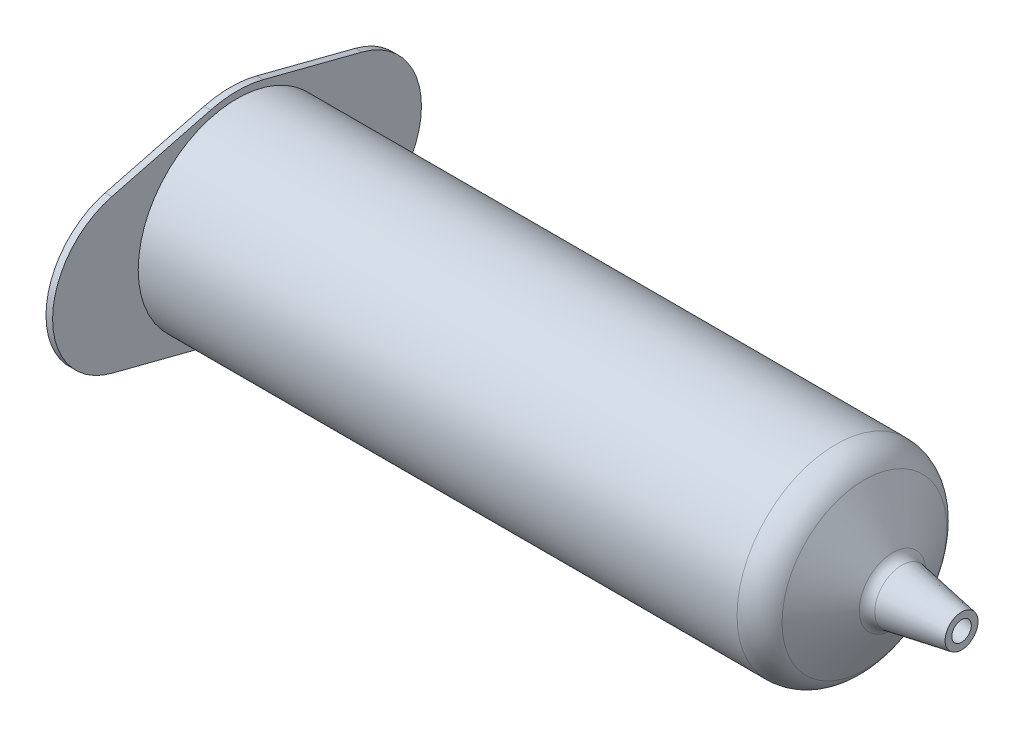
from build123d import *

# Parameters (mm, degrees)
BOSS_EXTRUDE1_DEPTH     = 90
FILLET1_R               = 7.5
FILLET2_R               = 2
SKETCH2_W               = 20
SKETCH2_H               = 80
SKETCH2_W_2             = 32
BOSS_EXTRUDE2_DEPTH     = 20
SKETCH3_R               = 2.5
BOSS_EXTRUDE3_DEPTH     = 111
BOSS_EXTRUDE4_START     = 7.5
SKETCH4_W               = 80
SKETCH4_H               = 20
SKETCH4_R               = 3.25
BOSS_EXTRUDE4_DEPTH     = 20
MOVE_FACE1_BY           = 1.5
MOVE_FACE2_BY           = 1.5
FILLET3_R               = 4
FILLET4_R               = 4
CUT_EXTRUDE1_DEPTH      = 2
BOSS_EXTRUDE5_DEPTH     = 2
SKETCH7_W               = 58
SKETCH7_H               = 15
CUT_EXTRUDE2_DEPTH      = 0.5
SKETCH8_R               = 10
BOSS_EXTRUDE6_DEPTH     = 1.5
SKETCH10_R              = 4.25
SKETCH10_R_2            = 2.75
CUT_EXTRUDE_THIN1_DEPTH = 1.5
SKETCH11_RX             = 5
SKETCH11_RY             = 2.5
BOSS_EXTRUDE7_DEPTH     = 1.5
LPATTERN1_COUNT         = 3
LPATTERN1_PITCH         = 24
SKETCH12_RX             = 5
SKETCH12_RY             = 2.5
BOSS_EXTRUDE8_DEPTH     = 1.5
LPATTERN2_START         = 113.13708499
LPATTERN2_DEPTH         = 1.5
FILLET7_R               = 7.5
FILLET5_R               = 5
FILLET6_R               = 2
SHELL1_T                = -1
SKETCH14_R              = 14
BOSS_EXTRUDE9_DEPTH     = 1
BOSS_EXTRUDE10_DEPTH    = 1
BOSS_EXTRUDE11_START    = -30
SKETCH16_R              = 13
BOSS_EXTRUDE11_DEPTH    = 10
BOSS_EXTRUDE12_REACH    = 233.484
SKETCH18_R              = 3
SKETCH17_W              = 1.5
SKETCH17_H              = 20
SKETCH17_W_2            = 20
SKETCH17_H_2            = 1.5
EXTRUDE_THIN1_DEPTH     = 63.5
SKETCH20_R              = 12.5
BOSS_EXTRUDE13_DEPTH    = 5
FILLET8_R               = 2


# Read off the part's stored shape, not the designer's step: LPattern2, Body-Move/Copy1
with BuildPart() as part:
    # Sketch1 → Boss-Extrude1 (new, symmetric)
    with BuildSketch(Plane(origin=(0, 0, 0), x_dir=(0, 0, -1), z_dir=(1, 0, 0))):
        Polygon((0, 0), (0, 45), (-115, 45), (-160, 0), align=None)
    extrude(amount=BOSS_EXTRUDE1_DEPTH, both=True)

    # Fillet1
    fillet1_edges = [part.edges().sort_by_distance(p)[0] for p in [
        (0, 0, 160),
        (0, 45, 115),
        (0, 45, 0),
        (0, 0, 0),
    ]]
    fillet(fillet1_edges, radius=FILLET1_R)

    # Fillet2
    fillet2_edges = [part.edges().sort_by_distance(p)[0] for p in [
        (-90, 0, 74.696699141),
        (90, 0, 74.696699141),
        (-90, 27.803300859, 132.196699141),
        (-90, 45, 59.696699141),
        (-90, 22.5, 0),
        (-90, 44.429096494, 114.763524025),
        (-90, 2.196699141, 2.196699141),
        (-90, 42.803300859, 2.196699141),
        (-90, 4.629874257, 148.822494776),
        (90, 27.803300859, 132.196699141),
        (90, 22.5, 0),
        (90, 45, 59.696699141),
        (90, 44.429096494, 114.763524025),
        (90, 2.196699141, 2.196699141),
        (90, 42.803300859, 2.196699141),
        (90, 4.629874257, 148.822494776),
    ]]
    fillet(fillet2_edges, radius=FILLET2_R)

    # Sketch2 → Boss-Extrude2 (add)
    with BuildSketch(Plane(origin=(0, 45, 0), x_dir=(1, 0, 0), z_dir=(0, 1, 0))):
        with Locations((-71.5, -59.696699141)):
            Rectangle(SKETCH2_W, SKETCH2_H)
        with Locations((65.5, -59.696699141)):
            Rectangle(SKETCH2_W_2, SKETCH2_H)
    extrude(amount=BOSS_EXTRUDE2_DEPTH)

    # Sketch3 → Boss-Extrude3 (add)
    with BuildSketch(Plane(origin=(-61.5, 0, 0), x_dir=(0, 0, -1), z_dir=(1, 0, 0))):
        with Locations(Location((-89.696699141, 59.5, 0), (0, 0, 180))):
            Circle(SKETCH3_R)
        with Locations(Location((-89.696699141, 50.5, 0), (0, 0, 180))):
            Circle(SKETCH3_R)
        with Locations(Location((-29.696699141, 50.5, 0), (0, 0, 180))):
            Circle(SKETCH3_R)
        with Locations(Location((-29.696699141, 59.5, 0), (0, 0, 180))):
            Circle(SKETCH3_R)
    extrude(amount=BOSS_EXTRUDE3_DEPTH)

    # Fillet3
    fillet3_edges = [part.edges().sort_by_distance(p)[0] for p in [
        (65.5, 65, 99.696699141),
        (65.5, 65, 19.696699141),
        (-71.5, 65, 99.696699141),
        (-71.5, 65, 19.696699141),
    ]]
    fillet(fillet3_edges, radius=FILLET3_R)

    # Sketch5 → Cut-Extrude1 (cut)
    with BuildSketch(Plane(origin=(0, 80, 80), x_dir=(1, 0, 0), z_dir=(0, 0.7071067811865511, 0.707106781186544))):
        with BuildLine():
            Line((-65, -56.317279836), (65, -56.317279836))
            ThreePointArc((65, -56.317279836), (66.767766953, -57.049512883), (67.5, -58.817279836))
            Line((67.5, -58.817279836), (67.5, -88.817279836))
            ThreePointArc((67.5, -88.817279836), (66.767766953, -90.585046789), (65, -91.317279836))
            Line((65, -91.317279836), (-65, -91.317279836))
            ThreePointArc((-65, -91.317279836), (-66.767766953, -90.585046789), (-67.5, -88.817279836))
            Line((-67.5, -88.817279836), (-67.5, -58.817279836))
            ThreePointArc((-67.5, -58.817279836), (-66.767766953, -57.049512883), (-65, -56.317279836))
        make_face()
    extrude(amount=-CUT_EXTRUDE1_DEPTH, mode=Mode.SUBTRACT)


with BuildPart() as body_2:
    # Sketch4 → Boss-Extrude4 (new body)
    with BuildSketch(Plane(origin=(-61.5, 0, 0), x_dir=(0, 0, -1), z_dir=(1, 0, 0)).offset(BOSS_EXTRUDE4_START)):
        with Locations((-59.696699141, 55)):
            Rectangle(SKETCH4_W, SKETCH4_H)
        with Locations((-89.696699141, 59.5)):
            Circle(SKETCH4_R, mode=Mode.SUBTRACT)
        with Locations((-89.696699141, 50.5)):
            Circle(SKETCH4_R, mode=Mode.SUBTRACT)
        with Locations((-29.696699141, 59.5)):
            Circle(SKETCH4_R, mode=Mode.SUBTRACT)
        with Locations((-29.696699141, 50.5)):
            Circle(SKETCH4_R, mode=Mode.SUBTRACT)
    extrude(amount=BOSS_EXTRUDE4_DEPTH)

    # Move Face1: a face moved outward by 1.5
    extrude(body_2.faces().sort_by_distance((-44, 65, 59.696699141))[0], amount=MOVE_FACE1_BY, dir=(0, 1, 0))

    # Move Face2: a face moved inward by 1.5
    extrude(body_2.faces().sort_by_distance((-44, 45, 59.696699141))[0], amount=MOVE_FACE2_BY, dir=(0, 1, 0), mode=Mode.SUBTRACT)

    # Fillet4
    fillet4_edges = [body_2.edges().sort_by_distance(p)[0] for p in [
        (-44, 66.5, 99.696699141),
        (-44, 66.5, 19.696699141),
        (-44, 46.5, 19.696699141),
        (-44, 46.5, 99.696699141),
    ]]
    fillet(fillet4_edges, radius=FILLET4_R)


with BuildPart() as body_3:
    # Sketch6 → Boss-Extrude5 (new body)
    with BuildSketch(Plane(origin=(0, 78.585786438, 78.585786438), x_dir=(1, 0, 0), z_dir=(0, 0.7071067811865509, 0.7071067811865441))):
        with BuildLine():
            Line((65, -56.317279836), (-65, -56.317279836))
            ThreePointArc((-65, -56.317279836), (-66.767766953, -57.049512883), (-67.5, -58.817279836))
            Line((-67.5, -58.817279836), (-67.5, -88.817279836))
            ThreePointArc((-67.5, -88.817279836), (-66.767766953, -90.585046789), (-65, -91.317279836))
            Line((-65, -91.317279836), (65, -91.317279836))
            ThreePointArc((65, -91.317279836), (66.767766953, -90.585046789), (67.5, -88.817279836))
            Line((67.5, -88.817279836), (67.5, -58.817279836))
            ThreePointArc((67.5, -58.817279836), (66.767766953, -57.049512883), (65, -56.317279836))
        make_face()
    extrude(amount=BOSS_EXTRUDE5_DEPTH)

    # Sketch7 → Cut-Extrude2 (cut)
    with BuildSketch(Plane(origin=(0, 80, 80), x_dir=(1, 0, 0), z_dir=(0, 0.7071067811865509, 0.7071067811865441))):
        with Locations((-28.5, -71.817279836)):
            Rectangle(SKETCH7_W, SKETCH7_H)
    extrude(amount=-CUT_EXTRUDE2_DEPTH, mode=Mode.SUBTRACT)

    # Sketch8 → Boss-Extrude6 (add)
    with BuildSketch(Plane(origin=(0, 80, 80), x_dir=(1, 0, 0), z_dir=(0, 0.7071067811865509, 0.7071067811865441))):
        with Locations(Location((15.5, -71.817279836, 0), (0, 0, 270))):
            Circle(SKETCH8_R)
    extrude(amount=BOSS_EXTRUDE6_DEPTH)

    # Sketch10 → Cut-Extrude-Thin1 (cut)
    # profile 1 of 5: a face of its own
    with BuildSketch(Plane(origin=(0, 81.060660172, 81.060660172), x_dir=(1, 0, 0), z_dir=(0, 0.7071067811865509, 0.7071067811865441))):
        with Locations((15.5, -71.817279836)):
            Circle(SKETCH10_R)
        with Locations((15.5, -71.817279836)):
            Circle(SKETCH10_R_2, mode=Mode.SUBTRACT)
    # profile 2 of 5: a face of its own
    with BuildSketch(Plane(origin=(0, 81.060660172, 81.060660172), x_dir=(1, 0, 0), z_dir=(0, 0.7071067811865509, 0.7071067811865441))):
        Polygon((7.898602102, -65.27654211), (12.49479618, -69.872736188), (13.555456352, -68.812076016), (8.959262274, -64.215881939), align=None)
    # profile 3 of 5: a face of its own
    with BuildSketch(Plane(origin=(0, 81.060660172, 81.060660172), x_dir=(1, 0, 0), z_dir=(0, 0.7071067811865509, 0.7071067811865441))):
        Polygon((22.040737726, -64.215881939), (17.444543648, -68.812076016), (18.50520382, -69.872736188), (23.101397898, -65.27654211), align=None)
    # profile 4 of 5: a face of its own
    with BuildSketch(Plane(origin=(0, 81.060660172, 81.060660172), x_dir=(1, 0, 0), z_dir=(0, 0.7071067811865509, 0.7071067811865441))):
        Polygon((17.444543648, -74.822483656), (22.040737726, -79.418677734), (23.101397898, -78.358017562), (18.50520382, -73.761823485), align=None)
    # profile 5 of 5: a face of its own
    with BuildSketch(Plane(origin=(0, 81.060660172, 81.060660172), x_dir=(1, 0, 0), z_dir=(0, 0.7071067811865509, 0.7071067811865441))):
        Polygon((12.49479618, -73.761823485), (7.898602102, -78.358017562), (8.959262274, -79.418677734), (13.555456352, -74.822483656), align=None)
    extrude(amount=-CUT_EXTRUDE_THIN1_DEPTH, mode=Mode.SUBTRACT)

    # Sketch11 → Boss-Extrude7 (add)
    with BuildSketch(Plane(origin=(0, 80, 80), x_dir=(1, 0, 0), z_dir=(0, 0.7071067811865509, 0.7071067811865441))):
        with Locations((-52.5, -85.317279836)):
            Ellipse(SKETCH11_RX, SKETCH11_RY)
    boss_extrude7 = extrude(amount=BOSS_EXTRUDE7_DEPTH)

    # LPattern1: Boss-Extrude7 ×3
    with Locations(*[(i * LPATTERN1_PITCH, 0, 0) for i in range(1, LPATTERN1_COUNT)]):
        add(boss_extrude7)

    # Sketch12 → Boss-Extrude8 (add)
    with BuildSketch(Plane(origin=(0, 80, 80), x_dir=(1, 0, 0), z_dir=(0, 0.7071067811865509, 0.7071067811865441))):
        with Locations((32.5, -66.317279836)):
            Ellipse(SKETCH12_RX, SKETCH12_RY)
    extrude(amount=BOSS_EXTRUDE8_DEPTH)

    # LPattern2 outline → LPattern2 (add)
    with BuildSketch(Plane(origin=(0, 0, 0), x_dir=(1, 0, 0), z_dir=(0, 0.707106781186551, 0.7071067811865439)).offset(LPATTERN2_START)):
        with BuildLine():
            add(Edge.make_bspline(
                [(37.5, -74.317279836), (37.5, -69.987152818), (30, -72.152216327), (22.5, -74.317279836), (30, -76.482343346), (37.5, -78.647406855), (37.5, -74.317279836)],
                knots=[0, 0, 0, 2.094395102, 2.094395102, 4.188790205, 4.188790205, 6.283185307, 6.283185307, 6.283185307], degree=2, weights=[1, 0.5, 1, 0.5, 1, 0.5, 1]))
        make_face()
        with BuildLine():
            add(Edge.make_bspline(
                [(37.5, -82.317279836), (37.5, -77.987152818), (30, -80.152216327), (22.5, -82.317279836), (30, -84.482343346), (37.5, -86.647406855), (37.5, -82.317279836)],
                knots=[0, 0, 0, 2.094395102, 2.094395102, 4.188790205, 4.188790205, 6.283185307, 6.283185307, 6.283185307], degree=2, weights=[1, 0.5, 1, 0.5, 1, 0.5, 1]))
        make_face()
        with BuildLine():
            add(Edge.make_bspline(
                [(49.5, -66.317279836), (49.5, -61.987152818), (42, -64.152216327), (34.5, -66.317279836), (42, -68.482343346), (49.5, -70.647406855), (49.5, -66.317279836)],
                knots=[0, 0, 0, 2.094395102, 2.094395102, 4.188790205, 4.188790205, 6.283185307, 6.283185307, 6.283185307], degree=2, weights=[1, 0.5, 1, 0.5, 1, 0.5, 1]))
        make_face()
        with BuildLine():
            add(Edge.make_bspline(
                [(49.5, -74.317279836), (49.5, -69.987152818), (42, -72.152216327), (34.5, -74.317279836), (42, -76.482343346), (49.5, -78.647406855), (49.5, -74.317279836)],
                knots=[0, 0, 0, 2.094395102, 2.094395102, 4.188790205, 4.188790205, 6.283185307, 6.283185307, 6.283185307], degree=2, weights=[1, 0.5, 1, 0.5, 1, 0.5, 1]))
        make_face()
        with BuildLine():
            add(Edge.make_bspline(
                [(49.5, -82.317279836), (49.5, -77.987152818), (42, -80.152216327), (34.5, -82.317279836), (42, -84.482343346), (49.5, -86.647406855), (49.5, -82.317279836)],
                knots=[0, 0, 0, 2.094395102, 2.094395102, 4.188790205, 4.188790205, 6.283185307, 6.283185307, 6.283185307], degree=2, weights=[1, 0.5, 1, 0.5, 1, 0.5, 1]))
        make_face()
        with BuildLine():
            add(Edge.make_bspline(
                [(61.5, -66.317279836), (61.5, -61.987152818), (54, -64.152216327), (46.5, -66.317279836), (54, -68.482343346), (61.5, -70.647406855), (61.5, -66.317279836)],
                knots=[0, 0, 0, 2.094395102, 2.094395102, 4.188790205, 4.188790205, 6.283185307, 6.283185307, 6.283185307], degree=2, weights=[1, 0.5, 1, 0.5, 1, 0.5, 1]))
        make_face()
        with BuildLine():
            add(Edge.make_bspline(
                [(61.5, -74.317279836), (61.5, -69.987152818), (54, -72.152216327), (46.5, -74.317279836), (54, -76.482343346), (61.5, -78.647406855), (61.5, -74.317279836)],
                knots=[0, 0, 0, 2.094395102, 2.094395102, 4.188790205, 4.188790205, 6.283185307, 6.283185307, 6.283185307], degree=2, weights=[1, 0.5, 1, 0.5, 1, 0.5, 1]))
        make_face()
        with BuildLine():
            add(Edge.make_bspline(
                [(61.5, -82.317279836), (61.5, -77.987152818), (54, -80.152216327), (46.5, -82.317279836), (54, -84.482343346), (61.5, -86.647406855), (61.5, -82.317279836)],
                knots=[0, 0, 0, 2.094395102, 2.094395102, 4.188790205, 4.188790205, 6.283185307, 6.283185307, 6.283185307], degree=2, weights=[1, 0.5, 1, 0.5, 1, 0.5, 1]))
        make_face()
    extrude(amount=LPATTERN2_DEPTH)


with BuildPart() as body_4:
    # Sketch13 → Revolve1 (revolve)
    with BuildSketch(Plane.XY.offset(59.696699141), mode=Mode.PRIVATE) as revolve1_sk:
        Polygon((11.5, 70), (11.5, 85), (105.301145933, 85), (111.5, 74.263269807), (121.5, 72.5), (121.5, 70), align=None)
    revolve(revolve1_sk.sketch.rotate(Axis((11.5, 70, 59.696699141), (1, 0, 0)), 90), axis=Axis((11.5, 70, 59.696699141), (1, 0, 0)))

    # Fillet5
    fillet5_edges = [body_4.edges().sort_by_distance(p)[0] for p in [
        (105.301145933, 70, 44.696699141),
    ]]
    fillet(fillet5_edges, radius=FILLET5_R)

    # Fillet6
    fillet6_edges = [body_4.edges().sort_by_distance(p)[0] for p in [
        (111.5, 70, 55.433429334),
    ]]
    fillet(fillet6_edges, radius=FILLET6_R)

    # Shell1
    shell1_openings = [body_4.faces().sort_by_distance(p)[0] for p in [
        (121.5, 70, 59.696699141),
        (11.5, 70, 59.696699141),
    ]]
    offset(amount=SHELL1_T, openings=shell1_openings, kind=Kind.INTERSECTION)

    # Sketch14 → Boss-Extrude9 (add)
    with BuildSketch(Plane.ZY.offset(-11.5)):
        with BuildLine():
            Line((55.696699141, 85.491933385), (40.696699141, 81.618950039))
            ThreePointArc((40.696699141, 81.618950039), (31.696699141, 70), (40.696699141, 58.381049961))
            Line((40.696699141, 58.381049961), (55.696699141, 54.508066615))
            ThreePointArc((55.696699141, 54.508066615), (59.696699141, 54), (63.696699141, 54.508066615))
            Line((63.696699141, 54.508066615), (78.696699141, 58.381049961))
            ThreePointArc((78.696699141, 58.381049961), (87.696699141, 70), (78.696699141, 81.618950039))
            Line((78.696699141, 81.618950039), (63.696699141, 85.491933385))
            ThreePointArc((63.696699141, 85.491933385), (59.696699141, 86), (55.696699141, 85.491933385))
        make_face()
        with Locations((59.696699141, 70)):
            Circle(SKETCH14_R, mode=Mode.SUBTRACT)
    extrude(amount=BOSS_EXTRUDE9_DEPTH)


with BuildPart() as body_5:
    # Body-Move/Copy1 outline → Body-Move/Copy1 (revolve)
    with BuildSketch(Plane(origin=(0, 70, 59.696699141), x_dir=(0, 1, 0), z_dir=(0, 0, -1))):
        Polygon((0, 121.5), (0, 11.5), (15, 11.5), (15, 105.301145933), (4.263269807, 111.5), (2.5, 121.5), align=None)
    revolve(axis=Axis((0, 70, 59.696699141), (1, 0, 0)))


with BuildPart() as part_1:
    add(part.part)

    # Combine1: cut body 5
    add(body_5.part, mode=Mode.SUBTRACT)

    # Fillet7
    fillet7_edges = [part_1.edges().sort_by_distance(p)[0] for p in [
        (65.5, 65, 73.838834765),
        (65.5, 65, 45.554563517),
    ]]
    fillet(fillet7_edges, radius=FILLET7_R)

    # Sketch20 → Boss-Extrude13 (add)
    with BuildSketch(Plane.XZ):
        with Locations(Location((-60, 116.893398282, 0), (0, 0, 90))):
            Circle(SKETCH20_R)
        with Locations(Location((-60, 32.5, 0), (0, 0, 90))):
            Circle(SKETCH20_R)
        with Locations(Location((60, 32.5, 0), (0, 0, 90))):
            Circle(SKETCH20_R)
        with Locations(Location((60, 116.893398282, 0), (0, 0, 90))):
            Circle(SKETCH20_R)
    extrude(amount=BOSS_EXTRUDE13_DEPTH)

    # Fillet8
    fillet8_edges = [part_1.edges().sort_by_distance(p)[0] for p in [
        (-60, -5, 104.393398282),
        (-60, -5, 20),
        (60, -5, 20),
        (60, -5, 104.393398282),
    ]]
    fillet(fillet8_edges, radius=FILLET8_R)


with BuildPart() as body_5_2:
    # Sketch15 → Boss-Extrude10 (new body)
    with BuildSketch(Plane(origin=(-34, 0, 0), x_dir=(0, 0, -1), z_dir=(1, 0, 0))):
        with BuildLine():
            Line((-63.696699141, 85.491933385), (-78.696699141, 81.618950039))
            ThreePointArc((-78.696699141, 81.618950039), (-87.696699141, 70), (-78.696699141, 58.381049961))
            Line((-78.696699141, 58.381049961), (-63.696699141, 54.508066615))
            ThreePointArc((-63.696699141, 54.508066615), (-59.696699141, 54), (-55.696699141, 54.508066615))
            Line((-55.696699141, 54.508066615), (-40.696699141, 58.381049961))
            ThreePointArc((-40.696699141, 58.381049961), (-31.696699141, 70), (-40.696699141, 81.618950039))
            Line((-40.696699141, 81.618950039), (-55.696699141, 85.491933385))
            ThreePointArc((-55.696699141, 85.491933385), (-59.696699141, 86), (-63.696699141, 85.491933385))
        make_face()
    extrude(amount=BOSS_EXTRUDE10_DEPTH)


with BuildPart() as body_6:
    # Sketch16 → Boss-Extrude11 (new body)
    with BuildSketch(Plane.ZY.offset(-10.5).offset(BOSS_EXTRUDE11_START)):
        with Locations((59.696699141, 70)):
            Circle(SKETCH16_R)
    extrude(amount=BOSS_EXTRUDE11_DEPTH)

    # Sketch18 → Boss-Extrude12 (add, up to next)
    with BuildSketch(Plane(origin=(-33, 0, 0), x_dir=(0, 0, -1), z_dir=(1, 0, 0)), mode=Mode.PRIVATE) as boss_extrude12_sk1:
        with Locations(Location((-59.696699141, 70, 0), (0, 0, 180))):
            Circle(SKETCH18_R)
    boss_extrude12_tool1 = extrude(boss_extrude12_sk1.sketch, amount=BOSS_EXTRUDE12_REACH, mode=Mode.PRIVATE) - body_6.part

    add(body_5_2.part)  # Boss-Extrude12 merges body 5 2
    add(boss_extrude12_tool1.solids().sort_by_distance((-33, 70, 59.696699))[0])

    # Sketch17 → Extrude-Thin1 (add)
    with BuildSketch(Plane(origin=(-33, 0, 0), x_dir=(0, 0, -1), z_dir=(1, 0, 0))):
        with Locations((-59.696699141, 70)):
            Rectangle(SKETCH17_W, SKETCH17_H)
        with Locations((-59.696699141, 70)):
            Rectangle(SKETCH17_W_2, SKETCH17_H_2)
    extrude(amount=EXTRUDE_THIN1_DEPTH)

    # Sketch19 → Cut-Revolve3 (revolve, cut)
    with BuildSketch(Plane.XY.offset(59.696699141), mode=Mode.PRIVATE) as cut_revolve3_sk:
        Polygon((-33, 76.452368755), (-18, 80), (-18, 81.618950039), (-33, 81.618950039), align=None)
    revolve(cut_revolve3_sk.sketch.rotate(Axis((111.5, 70, 59.696699141), (-1, 0, 0)), 270), axis=Axis((111.5, 70, 59.696699141), (-1, 0, 0)), mode=Mode.SUBTRACT)


solid = body_4.part
